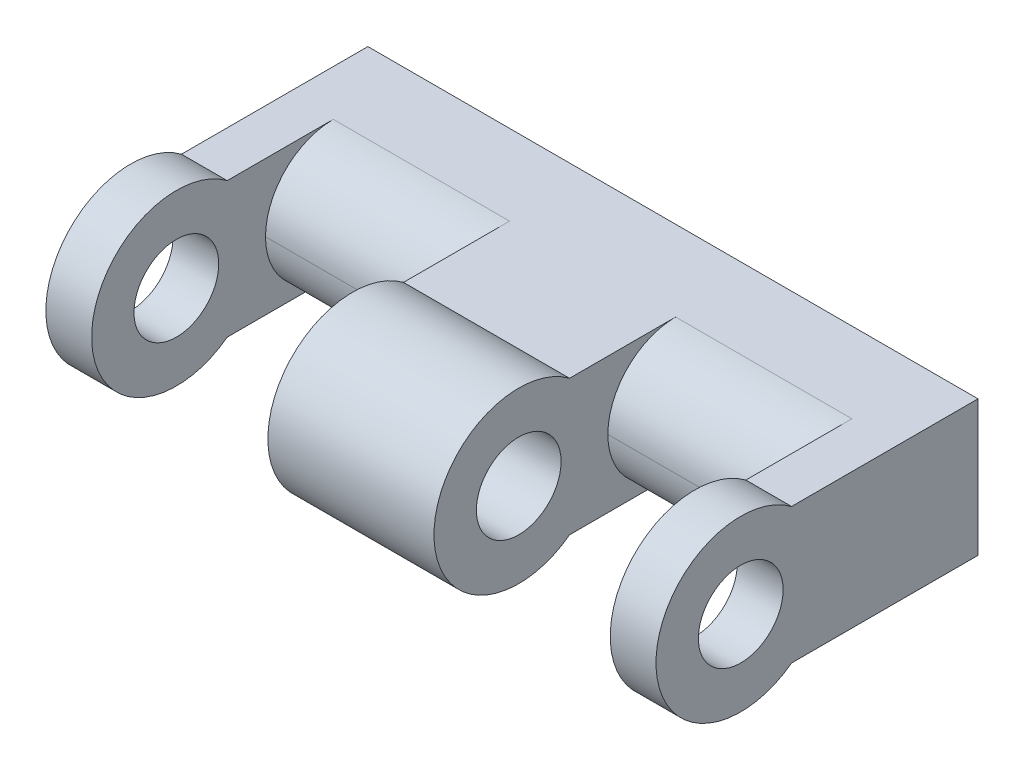
from build123d import *

# Parameters (mm, degrees)
SKETCH1_W           = 180
SKETCH1_H           = 40
BOSS_EXTRUDE1_DEPTH = 56
SKETCH2_W           = 150
SKETCH2_H           = 10
CUT_EXTRUDE1_DEPTH  = 40
SKETCH3_R           = 25
BOSS_EXTRUDE2_DEPTH = 24.5
BOSS_EXTRUDE3_START = -13.5
SKETCH4_R           = 25
BOSS_EXTRUDE3_DEPTH = 13.5
SKETCH6_R           = 12.5
CUT_EXTRUDE2_DEPTH  = 90
SKETCH10_W          = 11.29862099
SKETCH10_H          = 40
CUT_EXTRUDE4_DEPTH  = 52
SKETCH11_W          = 52
SKETCH11_H          = 40
CUT_EXTRUDE5_DEPTH  = 2
FILLET1_R           = 20


with BuildPart() as part:
    # Sketch1 → Boss-Extrude1 (new body)
    with BuildSketch(Plane.XY):
        with Locations((90, 20)):
            Rectangle(SKETCH1_W, SKETCH1_H)
    extrude(amount=BOSS_EXTRUDE1_DEPTH)

    # Sketch2 → Cut-Extrude1 (cut)
    with BuildSketch(Plane(origin=(0, 0, 0), x_dir=(-1, 0, 0), z_dir=(0, 0, -1))):
        with Locations((-90, 20)):
            Rectangle(SKETCH2_W, SKETCH2_H)
    extrude(amount=-CUT_EXTRUDE1_DEPTH, mode=Mode.SUBTRACT)

    # Sketch3 → Boss-Extrude2 (add)
    with BuildSketch(Plane(origin=(90, 0, 0), x_dir=(0, 0, -1), z_dir=(1, 0, 0))):
        with Locations((-70, 20)):
            Circle(SKETCH3_R)
    boss_extrude2 = extrude(amount=BOSS_EXTRUDE2_DEPTH)

    # Sketch4 → Boss-Extrude3 (add)
    with BuildSketch(Plane(origin=(180, 0, 0), x_dir=(0, 0, -1), z_dir=(1, 0, 0)).offset(BOSS_EXTRUDE3_START)):
        with Locations((-70, 20)):
            Circle(SKETCH4_R)
    boss_extrude3 = extrude(amount=BOSS_EXTRUDE3_DEPTH)

    # Sketch6 → Cut-Extrude2 (cut)
    with BuildSketch(Plane(origin=(180, 0, 0), x_dir=(0, 0, -1), z_dir=(1, 0, 0))):
        with Locations((-70, 20)):
            Circle(SKETCH6_R)
    cut_extrude2 = extrude(amount=-CUT_EXTRUDE2_DEPTH, mode=Mode.SUBTRACT)

    # Mirror1: Boss-Extrude2, Boss-Extrude3, Cut-Extrude2 across plane
    add(boss_extrude2.mirror(Plane(origin=(90, 0, 0), x_dir=(0, 0, 1), z_dir=(1, 0, 0))))
    add(boss_extrude3.mirror(Plane(origin=(90, 0, 0), x_dir=(0, 0, 1), z_dir=(1, 0, 0))))
    add(cut_extrude2.mirror(Plane(origin=(90, 0, 0), x_dir=(0, 0, 1), z_dir=(1, 0, 0))), mode=Mode.SUBTRACT)

    # Sketch10 → Cut-Extrude4 (cut)
    with BuildSketch(Plane(origin=(114.5, 0, 0), x_dir=(0, 0, -1), z_dir=(1, 0, 0))):
        with Locations((-49.350689505, 20)):
            Rectangle(SKETCH10_W, SKETCH10_H)
    cut_extrude4 = extrude(amount=CUT_EXTRUDE4_DEPTH, mode=Mode.SUBTRACT)

    # Mirror3: Cut-Extrude4 across plane
    add(cut_extrude4.mirror(Plane(origin=(90, 0, 0), x_dir=(0, 0, 1), z_dir=(1, 0, 0))), mode=Mode.SUBTRACT)

    # Sketch11 → Cut-Extrude5 (cut)
    with BuildSketch(Plane.XY.offset(56)):
        with Locations((140.5, 20)):
            Rectangle(SKETCH11_W, SKETCH11_H)
    cut_extrude5 = extrude(amount=-CUT_EXTRUDE5_DEPTH, mode=Mode.SUBTRACT)

    # Mirror4: Cut-Extrude5 across plane
    add(cut_extrude5.mirror(Plane(origin=(90, 0, 0), x_dir=(0, 0, 1), z_dir=(1, 0, 0))), mode=Mode.SUBTRACT)

    # Fillet1
    fillet1_edges = [part.edges().sort_by_distance(p)[0] for p in [
        (39.5, 40, 43.70137901),
        (39.5, 0, 43.70137901),
        (140.5, 40, 43.70137901),
        (140.5, 0, 43.70137901),
    ]]
    fillet(fillet1_edges, radius=FILLET1_R - 0.0001)  # a hair under: the kernel refuses the full size


solid = part.part
